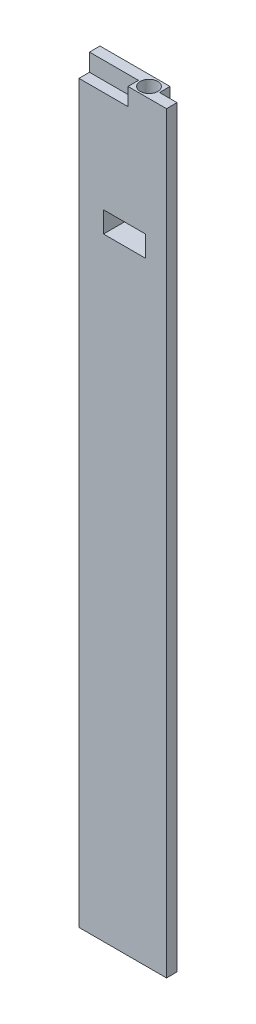
from build123d import *

# Parameters (mm, degrees)
BOSS_EXTRU_1_DEPTH      = 215
ESQUISSE2_W             = 14
ESQUISSE2_H             = 3
ENL_V_MAT_EXTRU_1_DEPTH = 5
ESQUISSE3_W             = 12
ESQUISSE3_H             = 6
ENL_V_MAT_EXTRU_2_DEPTH = 217.531752868
ESQUISSE4_R             = 2.5
ENL_V_MAT_EXTRU_3_DEPTH = 10


with BuildPart() as part:
    # Esquisse1 → Boss.-Extru.1 (new body)
    with BuildSketch(Plane(origin=(0, 0, 0), x_dir=(1, 0, 0), z_dir=(0, 1, 0))):
        Polygon((0, 0), (0, 6), (20, 6), (20, 3), (25, 3), (25, 0), align=None)
    extrude(amount=BOSS_EXTRU_1_DEPTH)

    # Esquisse2 → Enlèv. mat.-Extru.1 (cut)
    with BuildSketch(Plane(origin=(0, 215, 0), x_dir=(1, 0, 0), z_dir=(0, 1, 0))):
        with Locations((7, 1.5)):
            Rectangle(ESQUISSE2_W, ESQUISSE2_H)
    extrude(amount=-ENL_V_MAT_EXTRU_1_DEPTH, mode=Mode.SUBTRACT)

    # Esquisse3 → Enlèv. mat.-Extru.2 (cut, through all)
    with BuildSketch(Plane.XY):
        with Locations((13, 178)):
            Rectangle(ESQUISSE3_W, ESQUISSE3_H)
    extrude(amount=-ENL_V_MAT_EXTRU_2_DEPTH, mode=Mode.SUBTRACT)

    # Esquisse4 → Enlèv. mat.-Extru.3 (cut)
    with BuildSketch(Plane(origin=(0, 215, 0), x_dir=(1, 0, 0), z_dir=(0, 1, 0))):
        with Locations((17, 3)):
            Circle(ESQUISSE4_R)
    extrude(amount=-ENL_V_MAT_EXTRU_3_DEPTH, mode=Mode.SUBTRACT)


solid = part.part
